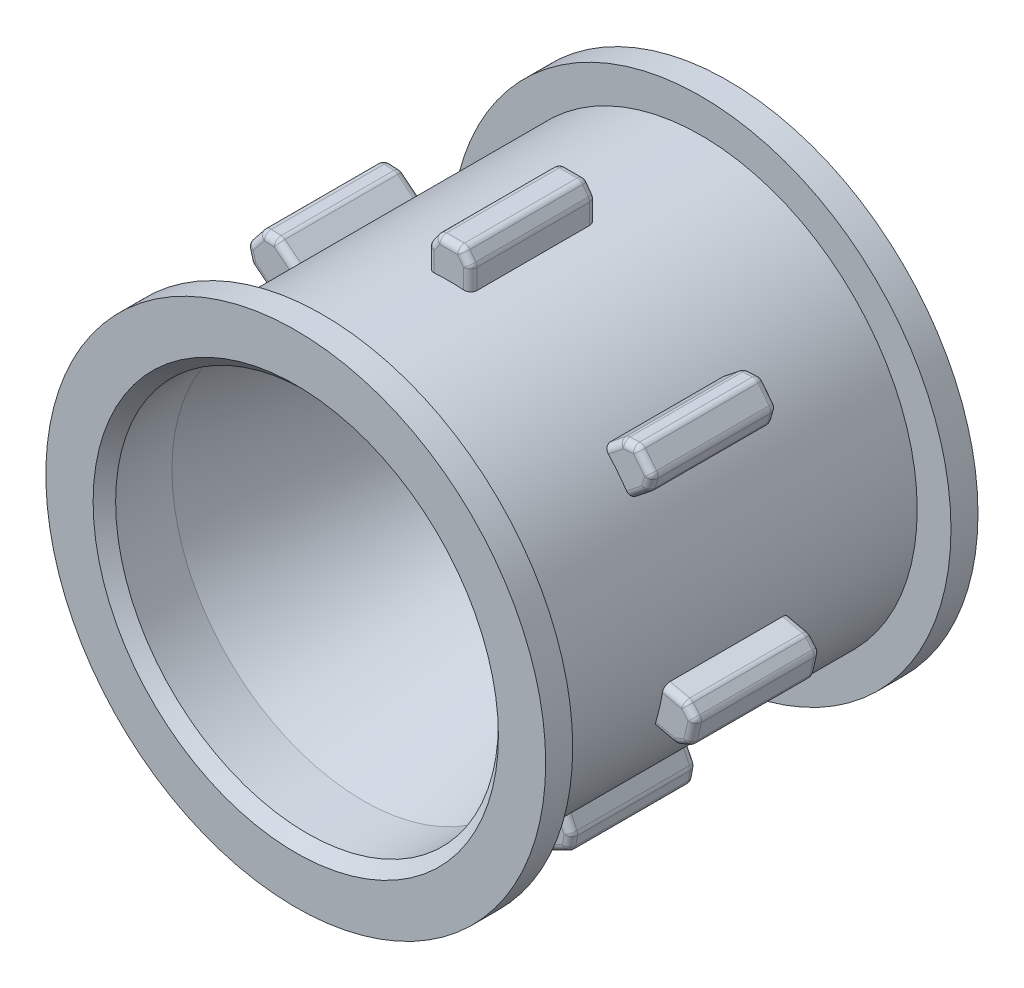
from build123d import *
from OCP.BRepFilletAPI import BRepFilletAPI_MakeChamfer

# Parameters (mm, degrees)
LAUFRAD_DEPTH                   = 8.4
LAUFRAD_DEPTH_BACK              = 8.4
SKIZZE1_R                       = 9.6
SKIZZE2_R                       = 11.1
KETTENF_HRUNG_DEPTH             = 1.2
SKIZZE4_R                       = 1
SCHRAUBENBOHRUNG_M3_DEPTH       = 25.800403223
SKIZZE3_R                       = 4.1
KUGELLAGERSITZ_DEPTH            = 4
FASE1_SIZE                      = 0.5
FASE1_SIZE2                     = 0.670010699
ZAHN_DEPTH                      = 2.8
VERRUNDUNG1_R                   = 0.3
KREISMUSTER1_COUNT              = 7
VERRUNDUNG1_OF_KREISMUSTER1_R   = 0.3
SKIZZE8_W                       = 4
SKIZZE8_H                       = 17
AUSCHNITT_ANTRIEB_WAGE_DEPTH    = 2
SKIZZE10_W                      = 17
SKIZZE10_H                      = 7
SCHNITT_LINEAR_AUSTRAGEN2_DEPTH = 2


with BuildPart() as part:
    # Skizze1 → Laufrad (new, two sides: drawn at the far end of the back side and taken through both)
    with BuildSketch(Plane.XY.offset(-LAUFRAD_DEPTH_BACK)):
        Circle(SKIZZE1_R)
    extrude(amount=LAUFRAD_DEPTH + LAUFRAD_DEPTH_BACK)

    # Skizze2 → Kettenführung (add)
    with BuildSketch(Plane.XY.offset(8.4)):
        Circle(SKIZZE2_R)
    kettenf_hrung = extrude(amount=KETTENF_HRUNG_DEPTH)

    # Spiegeln Kettenführung: Kettenführung across plane
    add(kettenf_hrung.mirror(Plane.XY))

    # Skizze4 → SchraubenBohrung M3 (cut, through all)
    with BuildSketch(Plane(origin=(0, 0, -9.6), x_dir=(-1, 0, 0), z_dir=(0, 0, -1))):
        Circle(SKIZZE4_R)
    extrude(amount=-SCHRAUBENBOHRUNG_M3_DEPTH, mode=Mode.SUBTRACT)

    # Skizze3 → Kugellagersitz (cut)
    with BuildSketch(Plane(origin=(0, 0, -9.6), x_dir=(-1, 0, 0), z_dir=(0, 0, -1))):
        Circle(SKIZZE3_R)
    extrude(amount=-KUGELLAGERSITZ_DEPTH, mode=Mode.SUBTRACT)

    # Skizze5 → Schnitt-Rotation3 (revolve, cut)
    with BuildSketch(Plane(origin=(0, 0, 0), x_dir=(0, 0, -1), z_dir=(1, 0, 0))):
        Polygon((-9.6, 0), (-9.6, 8.5), (-6.6, 8.5), (4.1, 6), (4.1, 0), align=None)
    revolve(axis=Axis((0, 0, -8.4), (0, 0, 1)), mode=Mode.SUBTRACT)

    # Fase1: one chamfer whose edges measure the first distance from different faces: ONE call of the kernel's chamfer builder (chamfer() names one face for all edges)
    fase1_edges_1 = [part.edges().sort_by_distance(p)[0] for p in [
        (1, 0, -4.1),
        (1, 0, -5.6),
        (4.1, 0, -9.6),
        (0, -8.5, 9.6),
    ]]
    fase1_edges_2 = [part.edges().sort_by_distance(p)[0] for p in [
        (0, -6, -4.1),
    ]]
    fase1_side_2 = [part.faces().sort_by_distance(p)[0] for p in [
        (0, -5.830294373, -4.1),
    ]]
    fase1 = BRepFilletAPI_MakeChamfer(part.part.solid().wrapped)
    for e in fase1_edges_1:
        fase1.Add(FASE1_SIZE, e.wrapped)
    for e in fase1_edges_2:
        fase1.Add(FASE1_SIZE, FASE1_SIZE2, e.wrapped, fase1_side_2[0].wrapped)  # the first distance lies on this face
    add(Compound.cast(fase1.Shape()), mode=Mode.REPLACE)

    # Skizze6 → Zahn (add, symmetric)
    with BuildSketch(Plane.XY):
        Polygon((0.55, 11.1), (-0.55, 11.1), (-0.95, 10.542409848), (-0.95, 9.552879147), (0.95, 9.552879147), (0.95, 10.542409848), align=None)
    zahn = extrude(amount=ZAHN_DEPTH, both=True)

    # Verrundung1
    verrundung1_edges = [part.edges().sort_by_distance(p)[0] for p in [
        (0.95, 10.542409848, 0),
        (-0.95, 10.542409848, 0),
        (-0.95, 10.047644498, -2.8),
        (-0.75, 10.821204924, -2.8),
        (0, 11.1, -2.8),
        (0.75, 10.821204924, -2.8),
        (0.95, 10.047644498, -2.8),
        (-0.55, 11.1, 0),
        (0.55, 11.1, 0),
        (-0.95, 10.047644498, 2.8),
        (-0.75, 10.821204924, 2.8),
        (0, 11.1, 2.8),
        (0.75, 10.821204924, 2.8),
        (0.95, 10.047644498, 2.8),
    ]]
    fillet(verrundung1_edges, radius=VERRUNDUNG1_R)

    # Kreismuster1: Zahn ×7 about axis
    kreismuster1_axis = Axis((0, 0, -8.4), (0, 0, 1))
    for i in range(1, KREISMUSTER1_COUNT):
        add(zahn.rotate(kreismuster1_axis, i * 360 / KREISMUSTER1_COUNT))

    # Verrundung1 of Kreismuster1
    verrundung1_of_kreismuster1_edges = [part.edges().sort_by_distance(p)[0] for p in [
        (-7.650072609, 7.315824936, 0),
        (-8.834703232, 5.830345119, 0),
        (-8.447880105, 5.521863969, -2.8),
        (-8.927976039, 6.160537302, -2.8),
        (-8.678329455, 6.920736801, -2.8),
        (-7.992741337, 7.333284526, -2.8),
        (-7.263249481, 7.007343785, -2.8),
        (-9.021248846, 6.490729485, 0),
        (-8.335410064, 7.350744116, 0),
        (-8.447880105, 5.521863969, 2.8),
        (-8.927976039, 6.160537302, 2.8),
        (-8.678329455, 6.920736801, 2.8),
        (-7.992741337, 7.333284526, 2.8),
        (-7.263249481, 7.007343785, 2.8),
        (-10.48948451, -1.419725369, 0),
        (-10.066694735, -3.272088402, 0),
        (-9.584334185, -3.161992754, -2.8),
        (-10.383004023, -3.13914056, -2.8),
        (-10.821699825, -2.469982367, -2.8),
        (-10.716785424, -1.676748692, -2.8),
        (-10.00712396, -1.309629721, -2.8),
        (-10.699313312, -3.006192719, 0),
        (-10.944086339, -1.933772015, 0),
        (-9.584334185, -3.161992754, 2.8),
        (-10.383004023, -3.13914056, 2.8),
        (-10.821699825, -2.469982367, 2.8),
        (-10.716785424, -1.676748692, 2.8),
        (-10.00712396, -1.309629721, 2.8),
        (-5.430100629, -9.086193514, 0),
        (-3.71825978, -9.910572618, 0),
        (-3.503589139, -9.46480444, -2.8),
        (-4.019418203, -10.074981554, -2.8),
        (-4.816109504, -10.000754434, -2.8),
        (-5.370871505, -9.424155945, -2.8),
        (-5.215429988, -8.640425336, -2.8),
        (-4.320576627, -10.23939049, 0),
        (-5.311642382, -9.762118377, 0),
        (-3.503589139, -9.46480444, 2.8),
        (-4.019418203, -10.074981554, 2.8),
        (-4.816109504, -10.000754434, 2.8),
        (-5.370871505, -9.424155945, 2.8),
        (-5.215429988, -8.640425336, 2.8),
        (3.71825978, -9.910572618, 0),
        (5.430100629, -9.086193514, 0),
        (5.215429988, -8.640425336, -2.8),
        (5.370871505, -9.424155945, -2.8),
        (4.816109504, -10.000754434, -2.8),
        (4.019418203, -10.074981554, -2.8),
        (3.503589139, -9.46480444, -2.8),
        (5.311642382, -9.762118377, 0),
        (4.320576627, -10.23939049, 0),
        (5.215429988, -8.640425336, 2.8),
        (5.370871505, -9.424155945, 2.8),
        (4.816109504, -10.000754434, 2.8),
        (4.019418203, -10.074981554, 2.8),
        (3.503589139, -9.46480444, 2.8),
        (10.066694735, -3.272088402, 0),
        (10.48948451, -1.419725369, 0),
        (10.00712396, -1.309629721, -2.8),
        (10.716785424, -1.676748692, -2.8),
        (10.821699825, -2.469982367, -2.8),
        (10.383004023, -3.13914056, -2.8),
        (9.584334185, -3.161992754, -2.8),
        (10.944086339, -1.933772015, 0),
        (10.699313312, -3.006192719, 0),
        (10.00712396, -1.309629721, 2.8),
        (10.716785424, -1.676748692, 2.8),
        (10.821699825, -2.469982367, 2.8),
        (10.383004023, -3.13914056, 2.8),
        (9.584334185, -3.161992754, 2.8),
        (8.834703232, 5.830345119, 0),
        (7.650072609, 7.315824936, 0),
        (7.263249481, 7.007343785, -2.8),
        (7.992741337, 7.333284526, -2.8),
        (8.678329455, 6.920736801, -2.8),
        (8.927976039, 6.160537302, -2.8),
        (8.447880105, 5.521863969, -2.8),
        (8.335410064, 7.350744116, 0),
        (9.021248846, 6.490729485, 0),
        (7.263249481, 7.007343785, 2.8),
        (7.992741337, 7.333284526, 2.8),
        (8.678329455, 6.920736801, 2.8),
        (8.927976039, 6.160537302, 2.8),
        (8.447880105, 5.521863969, 2.8),
    ]]
    fillet(verrundung1_of_kreismuster1_edges, radius=VERRUNDUNG1_OF_KREISMUSTER1_R)

    # Skizze8 → Auschnitt Antrieb Wage (cut)
    with BuildSketch(Plane(origin=(0, 0, -9.6), x_dir=(-1, 0, 0), z_dir=(0, 0, -1))):
        Rectangle(SKIZZE8_W, SKIZZE8_H)
    extrude(amount=-AUSCHNITT_ANTRIEB_WAGE_DEPTH, mode=Mode.SUBTRACT)

    # Skizze10 → Schnitt-Linear austragen2 (cut)
    with BuildSketch(Plane(origin=(0, 0, -9.6), x_dir=(-1, 0, 0), z_dir=(0, 0, -1))):
        Rectangle(SKIZZE10_W, SKIZZE10_H)
    extrude(amount=-SCHNITT_LINEAR_AUSTRAGEN2_DEPTH, mode=Mode.SUBTRACT)


solid = part.part
